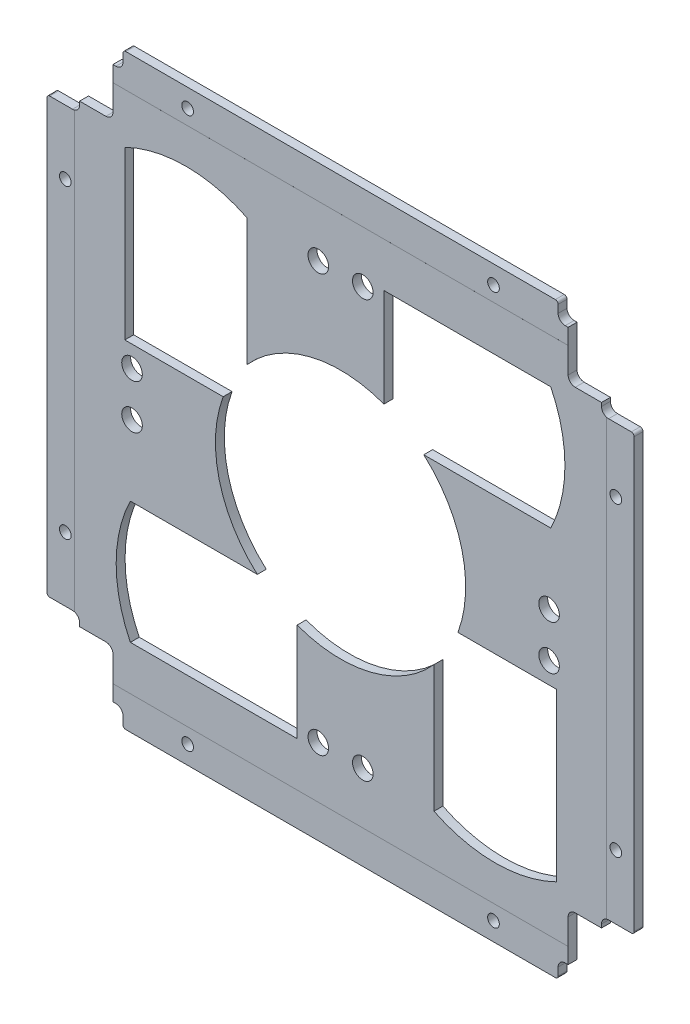
from build123d import *

# Parameters (mm, degrees)
SKETCH1_W                 = 106
SKETCH1_H                 = 106
MAINOUTLINE_DEPTH         = 1.6
SKETCH4_W                 = 11.7
SKETCH4_H                 = 11.7
RAILCUTOUTS_DEPTH         = 75.970394157
SKETCH13_W                = 5.7
SKETCH13_H                = 1.9
SKETCH13_W_2              = 1.8
SKETCH13_H_2              = 3
FILLETCUTOUTS_DEPTH       = 75.970394157
SMOOTHCORNER_DEPTH        = 10
MIRROR2_COPY_1_SKETCH_W   = 11.7
MIRROR2_COPY_1_SKETCH_H   = 11.7
MIRROR2_COPY_1_DEPTH      = 75.970394157
MIRROR2_COPY_2_SKETCH_W   = 5.7
MIRROR2_COPY_2_SKETCH_H   = 1.9
MIRROR2_COPY_2_SKETCH_W_2 = 1.8
MIRROR2_COPY_2_SKETCH_H_2 = 3
MIRROR2_COPY_2_DEPTH      = 75.970394157
MIRROR2_COPY_3_DEPTH      = 10
MIRROR2_COPY_4_SKETCH_W   = 11.7
MIRROR2_COPY_4_SKETCH_H   = 11.7
MIRROR2_COPY_4_DEPTH      = 75.970394157
MIRROR2_COPY_5_SKETCH_W   = 5.7
MIRROR2_COPY_5_SKETCH_H   = 1.9
MIRROR2_COPY_5_SKETCH_W_2 = 1.8
MIRROR2_COPY_5_SKETCH_H_2 = 3
MIRROR2_COPY_5_DEPTH      = 75.970394157
MIRROR2_COPY_6_DEPTH      = 10
M2_CLEARANCE_HOLE1_D      = 2.1
SKETCH16_W                = 90
SKETCH16_H                = 6.2
SKETCH16_W_2              = 5.2
SKETCH16_H_2              = 90
CUT_EXTRUDE6_DEPTH        = 0.001
CUT_EXTRUDE10_DEPTH       = 75.970394157
CUT_EXTRUDE10_DEPTH_BACK  = 75.970394157
SKETCH21_R                = 22.5
SKETCH24_OUTSIDE_W        = 137.984
SKETCH24_OUTSIDE_H        = 137.984
SKETCH24_OUTSIDE_W_2      = 105.6
SKETCH24_OUTSIDE_H_2      = 105.6
CUT_EXTRUDE19_DEPTH       = 75.970394157
FILLET7_R                 = 0.5
F_1_0MM_DOWEL_HOLE1_D     = 3.7
CUT_EXTRUDE23_DEPTH       = 75.687616109


with BuildPart() as part:
    # Sketch1 → mainOutline (new body)
    with BuildSketch(Plane.XY):
        Rectangle(SKETCH1_W, SKETCH1_H)
    extrude(amount=MAINOUTLINE_DEPTH)

    # Sketch4 → railCutouts (cut, through all)
    with BuildSketch(Plane(origin=(0, 0, 0), x_dir=(-1, 0, 0), z_dir=(0, 0, -1))):
        with Locations((47.15, 47.15)):
            Rectangle(SKETCH4_W, SKETCH4_H)
    railcutouts = extrude(amount=-RAILCUTOUTS_DEPTH, mode=Mode.SUBTRACT)

    # Sketch13 → filletCutouts (cut, symmetric)
    with BuildSketch(Plane(origin=(0, 0, 0), x_dir=(-1, 0, 0), z_dir=(0, 0, -1))):
        with Locations((50.15, 40.35)):
            Rectangle(SKETCH13_W, SKETCH13_H)
        with Locations((40.4, 51.5)):
            Rectangle(SKETCH13_W_2, SKETCH13_H_2)
    filletcutouts = extrude(amount=FILLETCUTOUTS_DEPTH, both=True, mode=Mode.SUBTRACT)

    # Sketch27 → smoothCorner (cut)
    with BuildSketch(Plane.XY.offset(1.6)):
        with BuildLine():
            Line((-40.928025612, 42.198025612), (-40.928025612, 49.628025612))
            Line((-40.928025612, 49.628025612), (-40.398025612, 49.628025612))
            ThreePointArc((-40.398025612, 49.628025612), (-39.5, 50), (-39.128025612, 50.898025612))
            Line((-39.128025612, 50.898025612), (-39.128025612, 53))
            Line((-39.128025612, 53), (-53, 53))
            Line((-53, 53), (-53, 39.028025612))
            Line((-53, 39.028025612), (-48.198025612, 39.028025612))
            ThreePointArc((-48.198025612, 39.028025612), (-47.3, 39.4), (-46.928025612, 40.298025612))
            Line((-46.928025612, 40.298025612), (-46.928025612, 40.928025612))
            Line((-46.928025612, 40.928025612), (-42.198025612, 40.928025612))
            ThreePointArc((-42.198025612, 40.928025612), (-41.3, 41.3), (-40.928025612, 42.198025612))
        make_face()
    smoothcorner = extrude(amount=-SMOOTHCORNER_DEPTH, mode=Mode.SUBTRACT)

    # Mirror1: railCutouts, filletCutouts, smoothCorner across plane
    add(railcutouts.mirror(Plane(origin=(0, 0, 0), x_dir=(0, 0, 1), z_dir=(1, 0, 0))), mode=Mode.SUBTRACT)
    add(filletcutouts.mirror(Plane(origin=(0, 0, 0), x_dir=(0, 0, 1), z_dir=(1, 0, 0))), mode=Mode.SUBTRACT)
    add(smoothcorner.mirror(Plane(origin=(0, 0, 0), x_dir=(0, 0, 1), z_dir=(1, 0, 0))), mode=Mode.SUBTRACT)

    # Mirror2 copy 1 sketch → Mirror2 copy 1 (cut, through all)
    with BuildSketch(Plane(origin=(0, 0, 0), x_dir=(1, 0, 0), z_dir=(0, 0, -1))):
        with Locations((47.15, 47.15)):
            Rectangle(MIRROR2_COPY_1_SKETCH_W, MIRROR2_COPY_1_SKETCH_H)
    extrude(amount=-MIRROR2_COPY_1_DEPTH, mode=Mode.SUBTRACT)

    # Mirror2 copy 2 sketch → Mirror2 copy 2 (cut, symmetric)
    with BuildSketch(Plane(origin=(0, 0, 0), x_dir=(1, 0, 0), z_dir=(0, 0, -1))):
        with Locations((50.15, 40.35)):
            Rectangle(MIRROR2_COPY_2_SKETCH_W, MIRROR2_COPY_2_SKETCH_H)
        with Locations((40.4, 51.5)):
            Rectangle(MIRROR2_COPY_2_SKETCH_W_2, MIRROR2_COPY_2_SKETCH_H_2)
    extrude(amount=MIRROR2_COPY_2_DEPTH, both=True, mode=Mode.SUBTRACT)

    # Mirror2 copy 3 sketch → Mirror2 copy 3 (cut)
    with BuildSketch(Plane(origin=(0, 0, 1.6), x_dir=(-1, 0, 0), z_dir=(0, 0, 1))):
        with BuildLine():
            Line((-40.928025612, 42.198025612), (-40.928025612, 49.628025612))
            Line((-40.928025612, 49.628025612), (-40.398025612, 49.628025612))
            ThreePointArc((-40.398025612, 49.628025612), (-39.5, 50), (-39.128025612, 50.898025612))
            Line((-39.128025612, 50.898025612), (-39.128025612, 53))
            Line((-39.128025612, 53), (-53, 53))
            Line((-53, 53), (-53, 39.028025612))
            Line((-53, 39.028025612), (-48.198025612, 39.028025612))
            ThreePointArc((-48.198025612, 39.028025612), (-47.3, 39.4), (-46.928025612, 40.298025612))
            Line((-46.928025612, 40.298025612), (-46.928025612, 40.928025612))
            Line((-46.928025612, 40.928025612), (-42.198025612, 40.928025612))
            ThreePointArc((-42.198025612, 40.928025612), (-41.3, 41.3), (-40.928025612, 42.198025612))
        make_face()
    extrude(amount=-MIRROR2_COPY_3_DEPTH, mode=Mode.SUBTRACT)

    # Mirror2 copy 4 sketch → Mirror2 copy 4 (cut, through all)
    with BuildSketch(Plane(origin=(0, 0, 0), x_dir=(-1, 0, 0), z_dir=(0, 0, -1))):
        with Locations((47.15, -47.15)):
            Rectangle(MIRROR2_COPY_4_SKETCH_W, MIRROR2_COPY_4_SKETCH_H)
    extrude(amount=-MIRROR2_COPY_4_DEPTH, mode=Mode.SUBTRACT)

    # Mirror2 copy 5 sketch → Mirror2 copy 5 (cut, symmetric)
    with BuildSketch(Plane(origin=(0, 0, 0), x_dir=(-1, 0, 0), z_dir=(0, 0, -1))):
        with Locations((50.15, -40.35)):
            Rectangle(MIRROR2_COPY_5_SKETCH_W, MIRROR2_COPY_5_SKETCH_H)
        with Locations((40.4, -51.5)):
            Rectangle(MIRROR2_COPY_5_SKETCH_W_2, MIRROR2_COPY_5_SKETCH_H_2)
    extrude(amount=MIRROR2_COPY_5_DEPTH, both=True, mode=Mode.SUBTRACT)

    # Mirror2 copy 6 sketch → Mirror2 copy 6 (cut)
    with BuildSketch(Plane.XY.offset(1.6)):
        with BuildLine():
            Line((-40.928025612, -42.198025612), (-40.928025612, -49.628025612))
            Line((-40.928025612, -49.628025612), (-40.398025612, -49.628025612))
            ThreePointArc((-40.398025612, -49.628025612), (-39.5, -50), (-39.128025612, -50.898025612))
            Line((-39.128025612, -50.898025612), (-39.128025612, -53))
            Line((-39.128025612, -53), (-53, -53))
            Line((-53, -53), (-53, -39.028025612))
            Line((-53, -39.028025612), (-48.198025612, -39.028025612))
            ThreePointArc((-48.198025612, -39.028025612), (-47.3, -39.4), (-46.928025612, -40.298025612))
            Line((-46.928025612, -40.298025612), (-46.928025612, -40.928025612))
            Line((-46.928025612, -40.928025612), (-42.198025612, -40.928025612))
            ThreePointArc((-42.198025612, -40.928025612), (-41.3, -41.3), (-40.928025612, -42.198025612))
        make_face()
    extrude(amount=-MIRROR2_COPY_6_DEPTH, mode=Mode.SUBTRACT)

    # M2 Clearance Hole1 (through all)
    with Locations(Plane(origin=(0, 0, 0), x_dir=(-1, 0, 0), z_dir=(0, 0, -1))):
        with Locations((49.5, -27.5), (27.5, -49.5), (-49.5, -27.5), (-27.5, -49.5), (-27.5, 49.5), (-49.5, 27.5), (27.5, 49.5), (49.5, 27.5)):
            Hole(M2_CLEARANCE_HOLE1_D / 2)

    # Sketch16 → Cut-Extrude6 (cut)
    with BuildSketch(Plane.XY.offset(1.6)):
        with Locations((0, -49.9)):
            Rectangle(SKETCH16_W, SKETCH16_H)
        with Locations((0, 49.9)):
            Rectangle(SKETCH16_W, SKETCH16_H)
        with Locations((-50.4, 0)):
            Rectangle(SKETCH16_W_2, SKETCH16_H_2)
        with Locations((50.4, 0)):
            Rectangle(SKETCH16_W_2, SKETCH16_H_2)
    extrude(amount=-CUT_EXTRUDE6_DEPTH, mode=Mode.SUBTRACT)

    # Sketch21 → Cut-Extrude10 (cut, two sides: drawn at the far end of the back side and taken through both)
    with BuildSketch(Plane.XY.offset(-CUT_EXTRUDE10_DEPTH_BACK)):
        Circle(SKETCH21_R)
    extrude(amount=CUT_EXTRUDE10_DEPTH + CUT_EXTRUDE10_DEPTH_BACK, mode=Mode.SUBTRACT)

    # Sketch24 outside → Cut-Extrude19 (cut, through all)
    with BuildSketch(Plane.XY.offset(1.6)):
        Rectangle(SKETCH24_OUTSIDE_W, SKETCH24_OUTSIDE_H)
        Rectangle(SKETCH24_OUTSIDE_W_2, SKETCH24_OUTSIDE_H_2, mode=Mode.SUBTRACT)
    extrude(amount=-CUT_EXTRUDE19_DEPTH, mode=Mode.SUBTRACT)

    # Fillet7
    fillet7_edges = [part.edges().sort_by_distance(p)[0] for p in [
        (-52.8, -39.028025612, 0.7995),
        (-39.128025612, -52.8, 0.7995),
        (39.128025612, -52.8, 0.7995),
        (52.8, -39.028025612, 0.7995),
        (52.8, 39.028025612, 0.7995),
        (39.128025612, 52.8, 0.7995),
        (-39.128025612, 52.8, 0.7995),
        (-52.8, 39.028025612, 0.7995),
    ]]
    fillet(fillet7_edges, radius=FILLET7_R)

    # Ø1.0mm Dowel Hole1 (through all)
    with Locations(Plane(origin=(-37.5, 4, 0), x_dir=(-1, 0, 0), z_dir=(0, 0, -1))):
        with Locations((0, 0), (0, -8), (-33.5, -41.5), (-41.5, -41.5), (-75, -8), (-75, 0), (-41.5, 33.5), (-33.5, 33.5)):
            Hole(F_1_0MM_DOWEL_HOLE1_D / 2)

    # Sketch33 → Cut-Extrude23 (cut, through all)
    with BuildSketch(Plane(origin=(0, 0, 0), x_dir=(-1, 0, 0), z_dir=(0, 0, -1))):
        with BuildLine():
            Line((-7.8, 16.8), (-7.8, 38.8))
            Line((-7.8, 38.8), (-37.8, 38.8))
            ThreePointArc((-37.8, 38.8), (-40.350055679, 27.8), (-37.8, 16.8))
            Line((-37.8, 16.8), (-7.8, 16.8))
        make_face()
        with BuildLine():
            Line((-16.8, -7.8), (-38.8, -7.8))
            Line((-38.8, -7.8), (-38.8, -37.8))
            ThreePointArc((-38.8, -37.8), (-27.8, -40.350055679), (-16.8, -37.8))
            Line((-16.8, -37.8), (-16.8, -7.8))
        make_face()
        with BuildLine():
            Line((16.8, 7.8), (38.8, 7.8))
            Line((38.8, 7.8), (38.8, 37.8))
            ThreePointArc((38.8, 37.8), (27.8, 40.350055679), (16.8, 37.8))
            Line((16.8, 37.8), (16.8, 7.8))
        make_face()
        with BuildLine():
            Line((7.8, -16.8), (7.8, -38.8))
            Line((7.8, -38.8), (37.8, -38.8))
            ThreePointArc((37.8, -38.8), (40.350055679, -27.8), (37.8, -16.8))
            Line((37.8, -16.8), (7.8, -16.8))
        make_face()
    extrude(amount=-CUT_EXTRUDE23_DEPTH, mode=Mode.SUBTRACT)


solid = part.part
